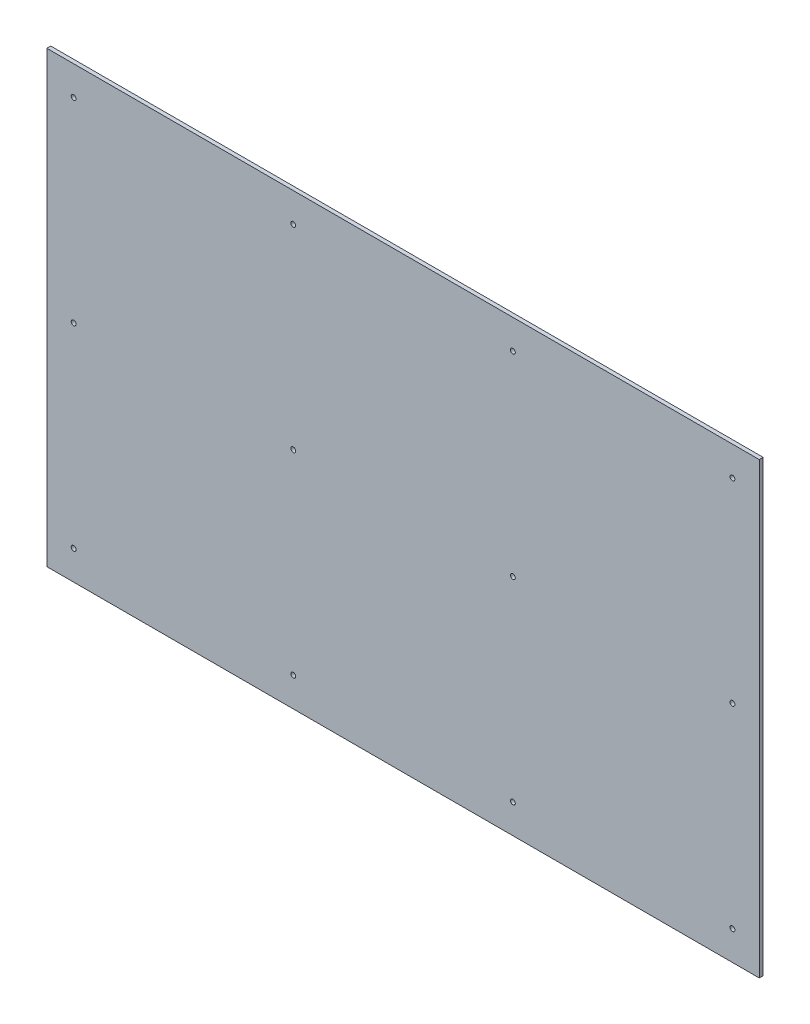
from build123d import *

# Parameters (mm, degrees)
IZIM1_W            = 1460
IZIM1_H            = 920
IZIM1_R            = 5
TABAN_FLAN_1_DEPTH = 8


# Sheet-metal steps are written as plain solids
with BuildPart() as part:
    # Çizim1 → Taban-Flanş1 (new body)
    with BuildSketch(Plane.XY):
        with Locations((3111.601078197, 1957.737800497)):
            Rectangle(IZIM1_W, IZIM1_H)
        with Locations((2436.601078197, 2357.737800497)):
            Circle(IZIM1_R, mode=Mode.SUBTRACT)
        with Locations((2886.601078197, 2357.737800497)):
            Circle(IZIM1_R, mode=Mode.SUBTRACT)
        with Locations((3336.601078197, 2357.737800497)):
            Circle(IZIM1_R, mode=Mode.SUBTRACT)
        with Locations((3786.601078197, 2357.737800497)):
            Circle(IZIM1_R, mode=Mode.SUBTRACT)
        with Locations((2436.601078197, 1957.737800497)):
            Circle(IZIM1_R, mode=Mode.SUBTRACT)
        with Locations((2886.601078197, 1957.737800497)):
            Circle(IZIM1_R, mode=Mode.SUBTRACT)
        with Locations((3336.601078197, 1957.737800497)):
            Circle(IZIM1_R, mode=Mode.SUBTRACT)
        with Locations((3786.601078197, 1957.737800497)):
            Circle(IZIM1_R, mode=Mode.SUBTRACT)
        with Locations((2436.601078197, 1557.737800497)):
            Circle(IZIM1_R, mode=Mode.SUBTRACT)
        with Locations((2886.601078197, 1557.737800497)):
            Circle(IZIM1_R, mode=Mode.SUBTRACT)
        with Locations((3336.601078197, 1557.737800497)):
            Circle(IZIM1_R, mode=Mode.SUBTRACT)
        with Locations((3786.601078197, 1557.737800497)):
            Circle(IZIM1_R, mode=Mode.SUBTRACT)
    extrude(amount=-TABAN_FLAN_1_DEPTH)


solid = part.part
